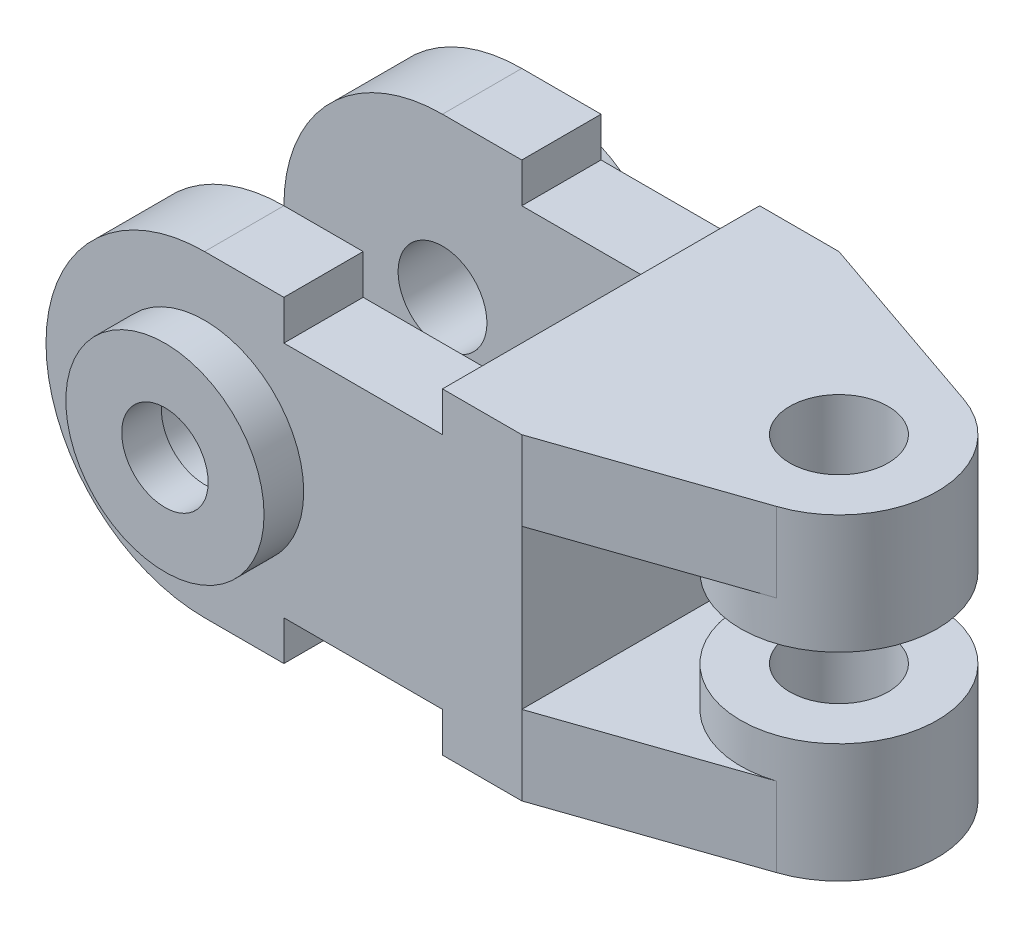
from build123d import *
from build123d.topology import SkipClean

# Parameters (mm, degrees)
SKETCH1_R           = 7.874
BOSS_EXTRUDE1_DEPTH = 50.8
SKETCH2_W           = 25.4
SKETCH2_H           = 6.35
SKETCH2_W_2         = 49.568192559
SKETCH2_H_2         = 25.4
SKETCH2_R           = 7.112
CUT_EXTRUDE1_DEPTH  = 86.106
SKETCH3_R           = 15.875
SKETCH3_R_2         = 6.921426928
BOSS_EXTRUDE2_DEPTH = 6.35
SKETCH4_R           = 15.875
SKETCH4_R_2         = 7.112
BOSS_EXTRUDE3_DEPTH = 6.35
SKETCH5_R           = 15.748
SKETCH5_R_2         = 7.874
BOSS_EXTRUDE4_DEPTH = 6.35
BOSS_EXTRUDE5_START = 6.35
SKETCH6_R           = 15.748
SKETCH6_R_2         = 7.874
BOSS_EXTRUDE5_DEPTH = 6.35


with BuildPart() as part:
    # Sketch1 → Boss-Extrude1 (new body)
    with BuildSketch(Plane(origin=(0, 0, 0), x_dir=(1, 0, 0), z_dir=(0, 1, 0))):
        with BuildLine():
            Line((-60.013493944, 26.069313577), (16.186506056, 26.069313577))
            Line((16.186506056, 26.069313577), (46.712972556, 15.559540077))
            ThreePointArc((46.712972556, 15.559540077), (57.334279676, 0.584874102), (46.55299975, -14.27503132))
            Line((46.55299975, -14.27503132), (16.186506056, -24.730686423))
            Line((16.186506056, -24.730686423), (-60.013493944, -24.730686423))
            Line((-60.013493944, -24.730686423), (-60.013493944, -12.030686423))
            Line((-60.013493944, -12.030686423), (3.486506056, -12.030686423))
            Line((3.486506056, -12.030686423), (3.486506056, 13.369313577))
            Line((3.486506056, 13.369313577), (-60.013493944, 13.369313577))
            Line((-60.013493944, 13.369313577), (-60.013493944, 26.069313577))
        make_face()
        with Locations((41.586506056, 0.669313577)):
            Circle(SKETCH1_R, mode=Mode.SUBTRACT)
    extrude(amount=BOSS_EXTRUDE1_DEPTH)

    # Sketch2 → Cut-Extrude1 (cut)
    with BuildSketch(Plane.XY.offset(24.730686423)):
        with BuildLine():
            ThreePointArc((-60.013493944, 25.4), (-52.574006186, 43.360512242), (-34.613493944, 50.8))
            Line((-34.613493944, 50.8), (-60.013493944, 50.8))
            Line((-60.013493944, 50.8), (-60.013493944, 25.4))
        make_face()
        with BuildLine():
            ThreePointArc((-34.613493944, 0), (-52.574006186, 7.439487758), (-60.013493944, 25.4))
            Line((-60.013493944, 25.4), (-60.013493944, 0))
            Line((-60.013493944, 0), (-34.613493944, 0))
        make_face()
        with Locations((-9.213493944, 47.625)):
            Rectangle(SKETCH2_W, SKETCH2_H)
        with Locations((-9.213493944, 3.175)):
            Rectangle(SKETCH2_W, SKETCH2_H)
        with Locations((40.970602336, 25.4)):
            Rectangle(SKETCH2_W_2, SKETCH2_H_2)
        with Locations((-34.613493944, 25.4)):
            Circle(SKETCH2_R)
    extrude(amount=-CUT_EXTRUDE1_DEPTH, mode=Mode.SUBTRACT)

    # Sketch3 → Boss-Extrude2 (add)
    with BuildSketch(Plane.XY.offset(24.730686423)):
        with Locations((-34.613493944, 25.4)):
            Circle(SKETCH3_R)
        with Locations((-34.613493944, 25.4)):
            Circle(SKETCH3_R_2, mode=Mode.SUBTRACT)
    extrude(amount=BOSS_EXTRUDE2_DEPTH)

    # Sketch4 → Boss-Extrude3 (add)
    with SkipClean():  # the faces are left unmerged after this step: merging them gives an invalid solid
        with BuildSketch(Plane(origin=(0, 0, -26.069313577), x_dir=(-1, 0, 0), z_dir=(0, 0, -1))):
            with Locations((34.613493944, 25.4)):
                Circle(SKETCH4_R)
            with Locations((34.613493944, 25.4)):
                Circle(SKETCH4_R_2, mode=Mode.SUBTRACT)
        extrude(amount=BOSS_EXTRUDE3_DEPTH)

    # Sketch5 → Boss-Extrude4 (add)
    with SkipClean():  # the faces are left unmerged after this step: merging them gives an invalid solid
        with BuildSketch(Plane(origin=(0, 12.7, 0), x_dir=(1, 0, 0), z_dir=(0, 1, 0))):
            with Locations((41.586506056, 0.669313577)):
                Circle(SKETCH5_R)
            with Locations((41.586506056, 0.669313577)):
                Circle(SKETCH5_R_2, mode=Mode.SUBTRACT)
        extrude(amount=BOSS_EXTRUDE4_DEPTH)
    add(part.part.scale(1), mode=Mode.REPLACE)  # the faces are merged on a copy

    # Sketch6 → Boss-Extrude5 (add)
    with BuildSketch(Plane.XZ.offset(-38.1).offset(BOSS_EXTRUDE5_START)):
        with Locations((41.586506056, -0.669313577)):
            Circle(SKETCH6_R)
        with Locations((41.586506056, -0.669313577)):
            Circle(SKETCH6_R_2, mode=Mode.SUBTRACT)
    extrude(amount=-BOSS_EXTRUDE5_DEPTH)


solid = part.part
